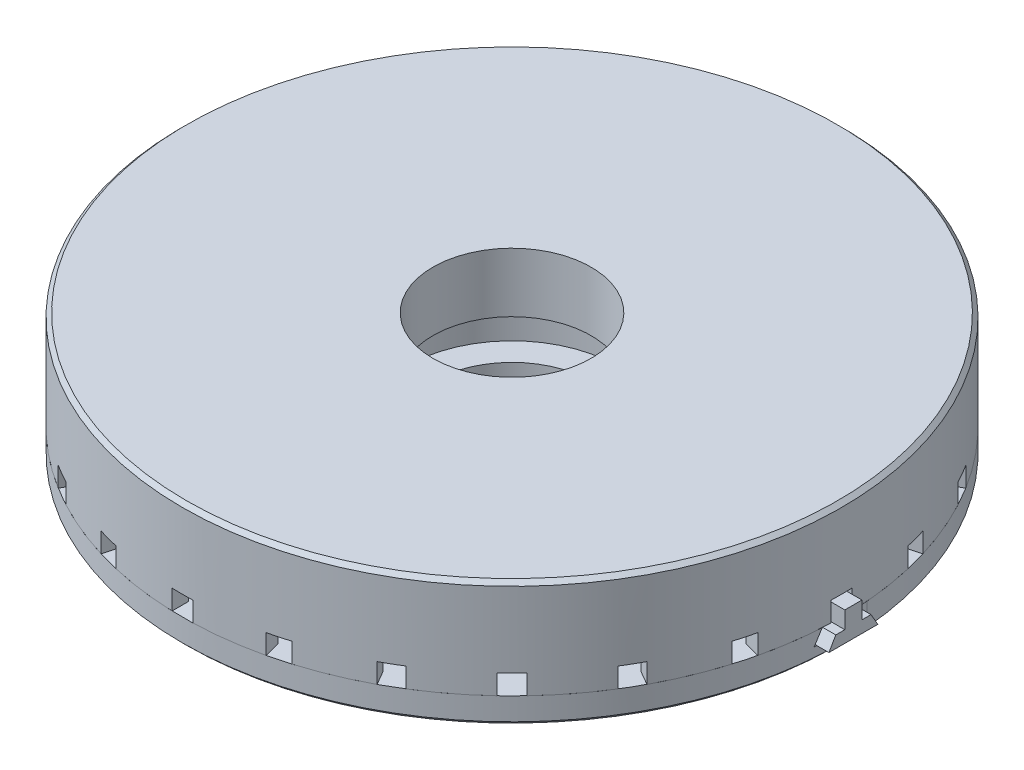
from build123d import *

# Parameters (mm, degrees)
CROQUIS_PLATO_R             = 50
PLATO_DEPTH                 = 3
FALDA_START                 = -12
CROQUIS_FALDA_R             = 50
CROQUIS_FALDA_R_2           = 47.5
FALDA_DEPTH                 = 12
CROQUIS_ESPIGA_R            = 15.75
CROQUIS_ESPIGA_R_2          = 12
ESPIGA_CENTRADO_DEPTH       = 6
PASO_CABLES_DEPTH           = 74.218850032
PASO_CABLES_DEPTH_BACK      = 74.218850032
CROQUIS_PASO_CABLES_R       = 12
SEPARAR_DEDOS_DEPTH         = 12
CROQUIS_MUESCAS_W           = 4.5
CROQUIS_MUESCAS_H           = 3.2
CROQUIS_MUESCAS_W_2         = 3.2
CROQUIS_MUESCAS_H_2         = 4.5
MUESCAS_SEGURO_DEPTH        = 3
CHAFLAN_CARA_SUPERIOR_SIZE  = 0.6
CROQUIS_BASE_R              = 50
BASE_DEPTH                  = 4
RANURAS_CLIC_DEPTH          = 9.1
PASO_CABLES_BASE_DEPTH      = 74.218850032
PASO_CABLES_BASE_DEPTH_BACK = 74.218850032
CROQUIS_PASO_CABLES_BASE_R  = 12
CANAL_SEGURO_DEPTH          = 103.383055239
CHAFLAN_BASE_SIZE           = 0.6
COSTILLAS_CLIC_DEPTH        = 2.5
COSTILLAS_CLIC_2_DEPTH      = 2.5
PASADOR_SEGURO_DEPTH        = 14.3
CROQUIS_DIENTE_W            = 4.8
CROQUIS_DIENTE_H            = 2.6
DIENTE_SEGURO_DEPTH         = 2.6


with BuildPart() as part:
    # Croquis_plato → Plato (new body)
    with BuildSketch(Plane(origin=(0, 16, 0), x_dir=(1, 0, 0), z_dir=(0, 1, 0))):
        Circle(CROQUIS_PLATO_R)
    extrude(amount=PLATO_DEPTH)

    # Croquis_falda → Falda (add)
    with BuildSketch(Plane(origin=(0, 16, 0), x_dir=(1, 0, 0), z_dir=(0, 1, 0)).offset(FALDA_START)):
        Circle(CROQUIS_FALDA_R)
        Circle(CROQUIS_FALDA_R_2, mode=Mode.SUBTRACT)
    extrude(amount=FALDA_DEPTH)

    # Croquis_dedos → Anillo_dedos (revolve)
    with BuildSketch(Plane.XY):
        Polygon((23.3, 16.5), (24.5, 16.5), (24.5, 4.5), (23, 4.5), (22.3, 5.2), (22.3, 5.5), (23.3, 6.5), align=None)
    revolve(axis=Axis((0, 0, 0), (0, 1, 0)))

    # Croquis_espiga → Espiga_centrado (add)
    with BuildSketch(Plane(origin=(0, 16, 0), x_dir=(1, 0, 0), z_dir=(0, 1, 0))):
        Circle(CROQUIS_ESPIGA_R)
        Circle(CROQUIS_ESPIGA_R_2, mode=Mode.SUBTRACT)
    extrude(amount=-ESPIGA_CENTRADO_DEPTH)

    # Croquis_paso_cables → Paso_cables (cut, two sides: drawn at the far end of the back side and taken through both)
    with BuildSketch(Plane(origin=(0, 0, 0), x_dir=(1, 0, 0), z_dir=(0, 1, 0)).offset(-PASO_CABLES_DEPTH_BACK)):
        Circle(CROQUIS_PASO_CABLES_R)
    extrude(amount=PASO_CABLES_DEPTH + PASO_CABLES_DEPTH_BACK, mode=Mode.SUBTRACT)

    # Croquis_separar_dedos → Separar_dedos (cut)
    with BuildSketch(Plane(origin=(0, 4, 0), x_dir=(1, 0, 0), z_dir=(0, 1, 0))):
        with BuildLine():
            Line((21.421432456, 4.553266029), (24.453690018, 5.19779227))
            ThreePointArc((24.453690018, 5.19779227), (23.096988313, 9.567085809), (20.966764199, 13.615975875))
            Line((20.966764199, 13.615975875), (18.366885438, 11.927594867))
            ThreePointArc((18.366885438, 11.927594867), (20.232961762, 8.380767169), (21.421432456, 4.553266029))
        make_face()
        with BuildLine():
            Line((11.927594867, 18.366885438), (13.615975875, 20.966764199))
            ThreePointArc((13.615975875, 20.966764199), (9.567085809, 23.096988313), (5.19779227, 24.453690018))
            Line((5.19779227, 24.453690018), (4.553266029, 21.421432456))
            ThreePointArc((4.553266029, 21.421432456), (8.380767169, 20.232961762), (11.927594867, 18.366885438))
        make_face()
        with BuildLine():
            Line((-4.553266029, 21.421432456), (-5.19779227, 24.453690018))
            ThreePointArc((-5.19779227, 24.453690018), (-9.567085809, 23.096988313), (-13.615975875, 20.966764199))
            Line((-13.615975875, 20.966764199), (-11.927594867, 18.366885438))
            ThreePointArc((-11.927594867, 18.366885438), (-8.380767169, 20.232961762), (-4.553266029, 21.421432456))
        make_face()
        with BuildLine():
            Line((-18.366885438, 11.927594867), (-20.966764199, 13.615975875))
            ThreePointArc((-20.966764199, 13.615975875), (-23.096988313, 9.567085809), (-24.453690018, 5.19779227))
            Line((-24.453690018, 5.19779227), (-21.421432456, 4.553266029))
            ThreePointArc((-21.421432456, 4.553266029), (-20.232961762, 8.380767169), (-18.366885438, 11.927594867))
        make_face()
        with BuildLine():
            Line((-21.421432456, -4.553266029), (-24.453690018, -5.19779227))
            ThreePointArc((-24.453690018, -5.19779227), (-23.096988313, -9.567085809), (-20.966764199, -13.615975875))
            Line((-20.966764199, -13.615975875), (-18.366885438, -11.927594867))
            ThreePointArc((-18.366885438, -11.927594867), (-20.232961762, -8.380767169), (-21.421432456, -4.553266029))
        make_face()
        with BuildLine():
            Line((-11.927594867, -18.366885438), (-13.615975875, -20.966764199))
            ThreePointArc((-13.615975875, -20.966764199), (-9.567085809, -23.096988313), (-5.19779227, -24.453690018))
            Line((-5.19779227, -24.453690018), (-4.553266029, -21.421432456))
            ThreePointArc((-4.553266029, -21.421432456), (-8.380767169, -20.232961762), (-11.927594867, -18.366885438))
        make_face()
        with BuildLine():
            Line((4.553266029, -21.421432456), (5.19779227, -24.453690018))
            ThreePointArc((5.19779227, -24.453690018), (9.567085809, -23.096988313), (13.615975875, -20.966764199))
            Line((13.615975875, -20.966764199), (11.927594867, -18.366885438))
            ThreePointArc((11.927594867, -18.366885438), (8.380767169, -20.232961762), (4.553266029, -21.421432456))
        make_face()
        with BuildLine():
            Line((18.366885438, -11.927594867), (20.966764199, -13.615975875))
            ThreePointArc((20.966764199, -13.615975875), (23.096988313, -9.567085809), (24.453690018, -5.19779227))
            Line((24.453690018, -5.19779227), (21.421432456, -4.553266029))
            ThreePointArc((21.421432456, -4.553266029), (20.232961762, -8.380767169), (18.366885438, -11.927594867))
        make_face()
    extrude(amount=SEPARAR_DEDOS_DEPTH, mode=Mode.SUBTRACT)

    # Croquis_muescas → Muescas_seguro (cut)
    with BuildSketch(Plane(origin=(0, 4, 0), x_dir=(1, 0, 0), z_dir=(0, 1, 0))):
        with Locations((48.75, 0)):
            Rectangle(CROQUIS_MUESCAS_W, CROQUIS_MUESCAS_H)
        Polygon((45.329661395, 10.489604275), (49.676327613, 11.654289978), (48.848106669, 14.745252622), (44.50144045, 13.580566919), align=None)
        Polygon((41.070181276, 21.864359354), (44.967295593, 24.114359354), (43.367295593, 26.885640646), (39.470181276, 24.635640646), align=None)
        Polygon((34.011836175, 31.749094475), (37.19381669, 34.931074991), (34.931074991, 37.19381669), (31.749094475, 34.011836175), align=None)
        Polygon((24.635640646, 39.470181276), (26.885640646, 43.367295593), (24.114359354, 44.967295593), (21.864359354, 41.070181276), align=None)
        Polygon((13.580566919, 44.50144045), (14.745252622, 48.848106669), (11.654289978, 49.676327613), (10.489604275, 45.329661395), align=None)
        with Locations((0, 48.75)):
            Rectangle(CROQUIS_MUESCAS_W_2, CROQUIS_MUESCAS_H_2)
        Polygon((-10.489604275, 45.329661395), (-11.654289978, 49.676327613), (-14.745252622, 48.848106669), (-13.580566919, 44.50144045), align=None)
        Polygon((-21.864359354, 41.070181276), (-24.114359354, 44.967295593), (-26.885640646, 43.367295593), (-24.635640646, 39.470181276), align=None)
        Polygon((-31.749094475, 34.011836175), (-34.931074991, 37.19381669), (-37.19381669, 34.931074991), (-34.011836175, 31.749094475), align=None)
        Polygon((-39.470181276, 24.635640646), (-43.367295593, 26.885640646), (-44.967295593, 24.114359354), (-41.070181276, 21.864359354), align=None)
        Polygon((-44.50144045, 13.580566919), (-48.848106669, 14.745252622), (-49.676327613, 11.654289978), (-45.329661395, 10.489604275), align=None)
        with Locations((-48.75, 0)):
            Rectangle(CROQUIS_MUESCAS_W, CROQUIS_MUESCAS_H)
        Polygon((-45.329661395, -10.489604275), (-49.676327613, -11.654289978), (-48.848106669, -14.745252622), (-44.50144045, -13.580566919), align=None)
        Polygon((-41.070181276, -21.864359354), (-44.967295593, -24.114359354), (-43.367295593, -26.885640646), (-39.470181276, -24.635640646), align=None)
        Polygon((-34.011836175, -31.749094475), (-37.19381669, -34.931074991), (-34.931074991, -37.19381669), (-31.749094475, -34.011836175), align=None)
        Polygon((-24.635640646, -39.470181276), (-26.885640646, -43.367295593), (-24.114359354, -44.967295593), (-21.864359354, -41.070181276), align=None)
        Polygon((-13.580566919, -44.50144045), (-14.745252622, -48.848106669), (-11.654289978, -49.676327613), (-10.489604275, -45.329661395), align=None)
        with Locations((0, -48.75)):
            Rectangle(CROQUIS_MUESCAS_W_2, CROQUIS_MUESCAS_H_2)
        Polygon((10.489604275, -45.329661395), (11.654289978, -49.676327613), (14.745252622, -48.848106669), (13.580566919, -44.50144045), align=None)
        Polygon((21.864359354, -41.070181276), (24.114359354, -44.967295593), (26.885640646, -43.367295593), (24.635640646, -39.470181276), align=None)
        Polygon((31.749094475, -34.011836175), (34.931074991, -37.19381669), (37.19381669, -34.931074991), (34.011836175, -31.749094475), align=None)
        Polygon((39.470181276, -24.635640646), (43.367295593, -26.885640646), (44.967295593, -24.114359354), (41.070181276, -21.864359354), align=None)
        Polygon((44.50144045, -13.580566919), (48.848106669, -14.745252622), (49.676327613, -11.654289978), (45.329661395, -10.489604275), align=None)
    extrude(amount=MUESCAS_SEGURO_DEPTH, mode=Mode.SUBTRACT)

    # Chaflan_cara_superior
    chaflan_cara_superior_edges = [part.edges().sort_by_distance(p)[0] for p in [
        (-50, 19, 0),
    ]]
    chamfer(chaflan_cara_superior_edges, length=CHAFLAN_CARA_SUPERIOR_SIZE)


with BuildPart() as body_2:
    # Croquis_base → Base (new body)
    with BuildSketch(Plane(origin=(0, 0, 0), x_dir=(1, 0, 0), z_dir=(0, 1, 0))):
        Circle(CROQUIS_BASE_R)
    extrude(amount=BASE_DEPTH)


with BuildPart() as body_3:
    # Croquis_nucleo → Nucleo (revolve)
    with BuildSketch(Plane.XY):
        Polygon((16, 3.5), (21.5, 3.5), (21.5, 5), (23, 6.5), (23, 14.6), (22, 15.6), (16, 15.6), align=None)
    revolve(axis=Axis((0, 0, 0), (0, 1, 0)))


with BuildPart() as body_2_1:
    add(body_2.part)

    # Sumar_nucleo_a_base: union body 3
    add(body_3.part)

    # Croquis_ranuras_clic → Ranuras_clic (cut)
    with BuildSketch(Plane(origin=(0, 15.6, 0), x_dir=(1, 0, 0), z_dir=(0, 1, 0))):
        Polygon((22.5, 0), (23.2, -0.7), (23.2, 0.7), align=None)
        Polygon((21.733331092, 5.823428515), (22.590652501, 5.328453768), (22.228305838, 6.680749925), align=None)
        Polygon((19.485571585, 11.25), (20.441789368, 10.993782217), (19.741789368, 12.206217783), align=None)
        Polygon((15.909902577, 15.909902577), (16.89985207, 15.909902577), (15.909902577, 16.89985207), align=None)
        Polygon((11.25, 19.485571585), (12.206217783, 19.741789368), (10.993782217, 20.441789368), align=None)
        Polygon((5.823428515, 21.733331092), (6.680749925, 22.228305838), (5.328453768, 22.590652501), align=None)
        Polygon((0, 22.5), (0.7, 23.2), (-0.7, 23.2), align=None)
        Polygon((-5.823428515, 21.733331092), (-5.328453768, 22.590652501), (-6.680749925, 22.228305838), align=None)
        Polygon((-11.25, 19.485571585), (-10.993782217, 20.441789368), (-12.206217783, 19.741789368), align=None)
        Polygon((-15.909902577, 15.909902577), (-15.909902577, 16.89985207), (-16.89985207, 15.909902577), align=None)
        Polygon((-19.485571585, 11.25), (-19.741789368, 12.206217783), (-20.441789368, 10.993782217), align=None)
        Polygon((-21.733331092, 5.823428515), (-22.228305838, 6.680749925), (-22.590652501, 5.328453768), align=None)
        Polygon((-22.5, 0), (-23.2, 0.7), (-23.2, -0.7), align=None)
        Polygon((-21.733331092, -5.823428515), (-22.590652501, -5.328453768), (-22.228305838, -6.680749925), align=None)
        Polygon((-19.485571585, -11.25), (-20.441789368, -10.993782217), (-19.741789368, -12.206217783), align=None)
        Polygon((-15.909902577, -15.909902577), (-16.89985207, -15.909902577), (-15.909902577, -16.89985207), align=None)
        Polygon((-11.25, -19.485571585), (-12.206217783, -19.741789368), (-10.993782217, -20.441789368), align=None)
        Polygon((-5.823428515, -21.733331092), (-6.680749925, -22.228305838), (-5.328453768, -22.590652501), align=None)
        Polygon((0, -22.5), (-0.7, -23.2), (0.7, -23.2), align=None)
        Polygon((5.823428515, -21.733331092), (5.328453768, -22.590652501), (6.680749925, -22.228305838), align=None)
        Polygon((11.25, -19.485571585), (10.993782217, -20.441789368), (12.206217783, -19.741789368), align=None)
        Polygon((15.909902577, -15.909902577), (15.909902577, -16.89985207), (16.89985207, -15.909902577), align=None)
        Polygon((19.485571585, -11.25), (19.741789368, -12.206217783), (20.441789368, -10.993782217), align=None)
        Polygon((21.733331092, -5.823428515), (22.228305838, -6.680749925), (22.590652501, -5.328453768), align=None)
    extrude(amount=-RANURAS_CLIC_DEPTH, mode=Mode.SUBTRACT)

    # Croquis_paso_cables_base → Paso_cables_base (cut, two sides: drawn at the far end of the back side and taken through both)
    with BuildSketch(Plane(origin=(0, 0, 0), x_dir=(1, 0, 0), z_dir=(0, 1, 0)).offset(-PASO_CABLES_BASE_DEPTH_BACK)):
        Circle(CROQUIS_PASO_CABLES_BASE_R)
    extrude(amount=PASO_CABLES_BASE_DEPTH + PASO_CABLES_BASE_DEPTH_BACK, mode=Mode.SUBTRACT)

    # Croquis_canal_seguro → Canal_seguro (cut, through all)
    with BuildSketch(Plane(origin=(37.3, 0, 0), x_dir=(0, 0, -1), z_dir=(1, 0, 0))):
        Polygon((-4, 2), (4, 2), (2.845299462, 4), (-2.845299462, 4), align=None)
    extrude(amount=CANAL_SEGURO_DEPTH, mode=Mode.SUBTRACT)

    # Chaflan_base
    chaflan_base_edges = [body_2_1.edges().sort_by_distance(p)[0] for p in [
        (-50, 0, 0),
    ]]
    chamfer(chaflan_base_edges, length=CHAFLAN_BASE_SIZE)


with BuildPart() as body_3_2:
    # Croquis_costillas_clic → Costillas_clic (new body)
    with BuildSketch(Plane(origin=(0, 6.8, 0), x_dir=(1, 0, 0), z_dir=(0, 1, 0))):
        Polygon((0, 22.7), (0.7, 23.4), (-0.7, 23.4), align=None)
    extrude(amount=COSTILLAS_CLIC_DEPTH)


with BuildPart() as body_4:
    # Croquis_costillas_clic → Costillas_clic 2 (new body)
    with BuildSketch(Plane(origin=(0, 6.8, 0), x_dir=(1, 0, 0), z_dir=(0, 1, 0))):
        Polygon((0, -22.7), (-0.7, -23.4), (0.7, -23.4), align=None)
    extrude(amount=COSTILLAS_CLIC_2_DEPTH)


with BuildPart() as part_1:
    add(part.part)

    # Sumar_costillas_a_plato: union body 3 2, body 4
    add(body_3_2.part)
    add(body_4.part)


with BuildPart() as body_3_3:
    # Croquis_seguro → Pasador_seguro (new body)
    with BuildSketch(Plane(origin=(37.5, 0, 0), x_dir=(0, 0, -1), z_dir=(1, 0, 0))):
        Polygon((-3.711324865, 2.1), (3.711324865, 2.1), (2.672094381, 3.9), (-2.672094381, 3.9), align=None)
    extrude(amount=PASADOR_SEGURO_DEPTH)


with BuildPart() as body_4_2:
    # Croquis_diente → Diente_seguro (new body)
    with BuildSketch(Plane(origin=(0, 3.9, 0), x_dir=(1, 0, 0), z_dir=(0, 1, 0))):
        with Locations((49.4, 0)):
            Rectangle(CROQUIS_DIENTE_W, CROQUIS_DIENTE_H)
    extrude(amount=DIENTE_SEGURO_DEPTH)


with BuildPart() as body_3_3_1:
    add(body_3_3.part)

    # Sumar_diente_a_seguro: union body 4 2
    add(body_4_2.part)


solid = Compound([body_2_1.part, part_1.part, body_3_3_1.part])
